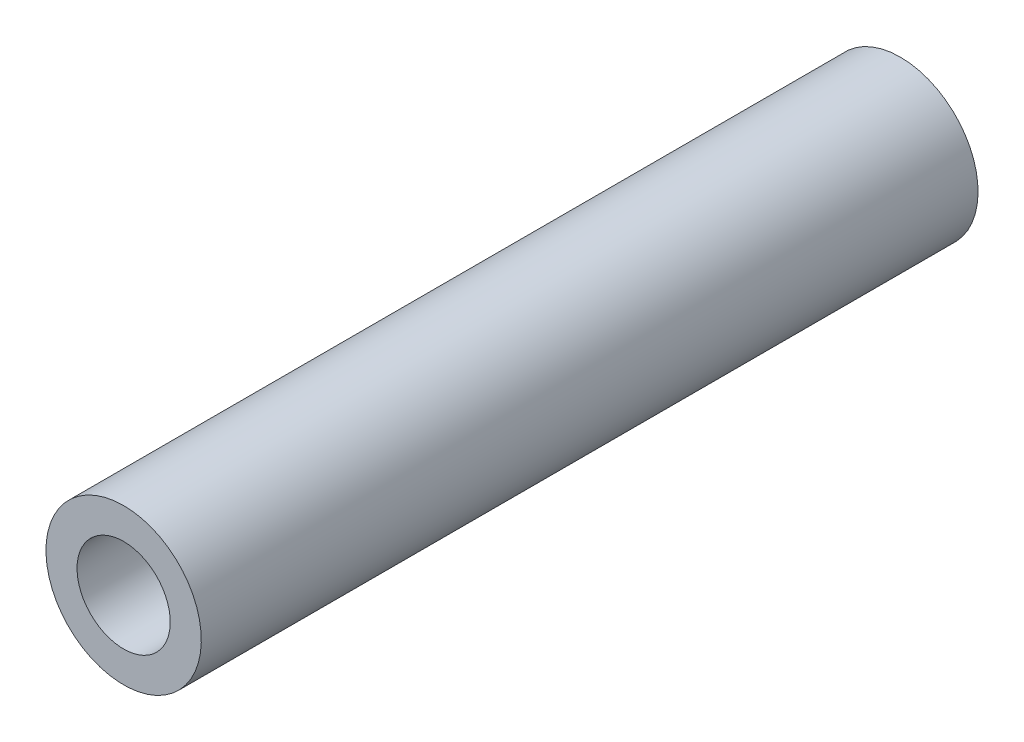
from build123d import *


with BuildPart() as part:
    # Sketch1 → Revolve1 (revolve)
    with BuildSketch(Plane(origin=(0, 0, 0), x_dir=(0, 0, -1), z_dir=(1, 0, 0))):
        Polygon((10, 0), (10, 3), (0, 3), (0, 5), (50, 5), (50, 3), (40, 3), (40, 0), align=None)
    revolve(axis=Axis((0, 0, -40), (0, 0, 1)))


solid = part.part
